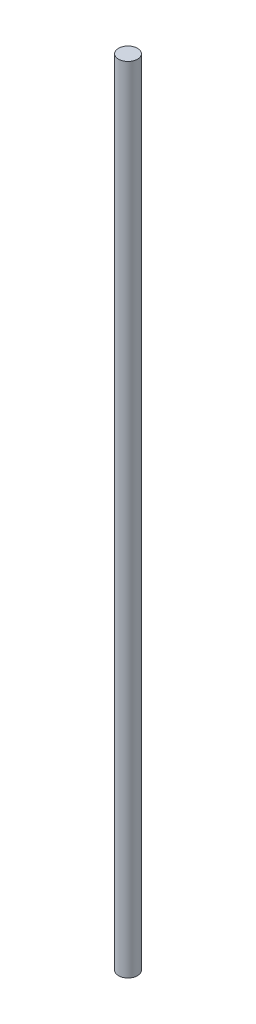
from build123d import *

# Parameters (mm, degrees)
SKETCH1_R           = 4
BOSS_EXTRUDE1_DEPTH = 335


with BuildPart() as part:
    # Sketch1 → Boss-Extrude1 (new body)
    with BuildSketch(Plane(origin=(0, 0, 0), x_dir=(1, 0, 0), z_dir=(0, 1, 0))):
        Circle(SKETCH1_R)
    extrude(amount=BOSS_EXTRUDE1_DEPTH)


solid = part.part
